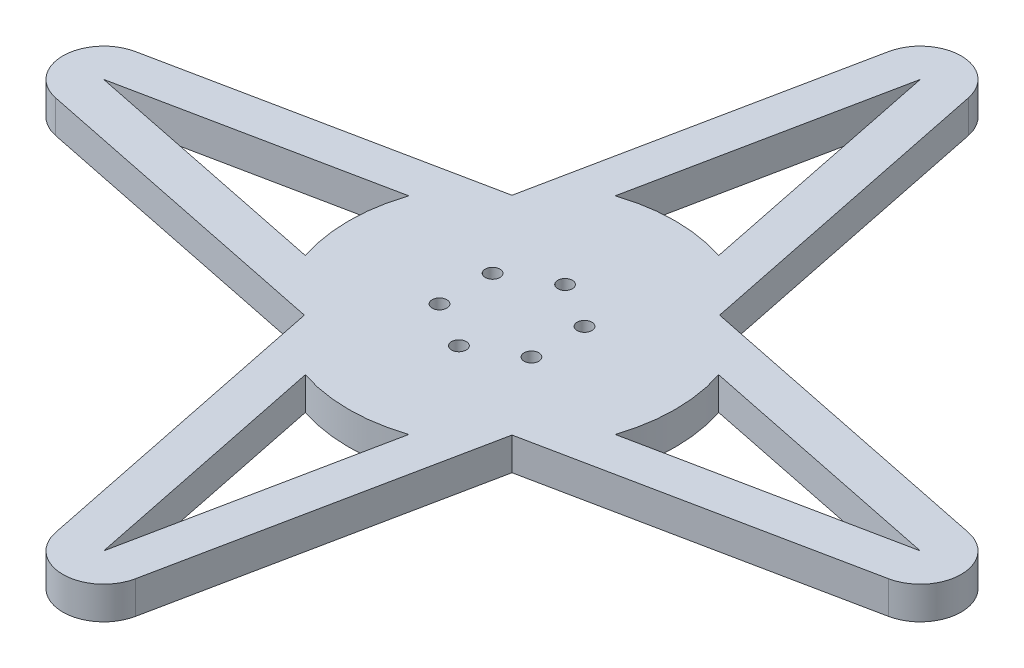
from build123d import *

# Parameters (mm, degrees)
BOSS_EXTRUDE1_DEPTH = 8
CIRPATTERN1_COUNT   = 4


# Read off the part's stored shape, not the designer's step: CSK for M3 Hex Socket Countersunk Cap Screw1
with BuildPart() as part:
    # Sketch2 → Boss-Extrude1 (new body)
    with BuildSketch(Plane(origin=(0, 0, 0), x_dir=(1, 0, 0), z_dir=(0, 1, 0))):
        with BuildLine():
            Line((6, -29.393876913), (102, -9.797958971))
            ThreePointArc((102, -9.797958971), (110, 0), (102, 9.797958971))
            Line((102, 9.797958971), (6, 29.393876913))
            ThreePointArc((6, 29.393876913), (-30, 0), (6, -29.393876913))
        make_face()
        with BuildLine():
            Line((37.941125497, -12.667714712), (100, 0))
            Line((100, 0), (37.941125497, 12.667714712))
            ThreePointArc((37.941125497, 12.667714712), (40, 0), (37.941125497, -12.667714712))
        make_face(mode=Mode.SUBTRACT)
    boss_extrude1 = extrude(amount=BOSS_EXTRUDE1_DEPTH)

    # CirPattern1: Boss-Extrude1 ×4 about axis
    cirpattern1_axis = Axis((0, 0, 0), (0, 1, 0))
    for i in range(1, CIRPATTERN1_COUNT):
        add(boss_extrude1.rotate(cirpattern1_axis, i * 360 / CIRPATTERN1_COUNT))

    # CSK for M3 Hex Socket Countersunk Ca 2 → CSK for M3 Hex Socket Countersunk Cap Screw1 (revolve, cut)
    with BuildSketch(Plane(origin=(-11.258330249, 0, -6.5), x_dir=(1, 0, 0), z_dir=(0, 0, 1))):
        Polygon((1.8, 1.56), (1.8, 8), (0, 8), (0, 0), (3.36, 0), align=None)
    revolve(axis=Axis((-11.258330249, 0, -6.5), (0, 1, 0)), mode=Mode.SUBTRACT)

    # CSK for M3 Hex Socket Countersunk Ca 3 o → CSK for M3 Hex Socket Countersunk Ca 3 (revolve, cut)
    with BuildSketch(Plane(origin=(-11.258330249, 0, 6.5), x_dir=(1, 0, 0), z_dir=(0, 0, 1))):
        Polygon((1.8, 1.56), (1.8, 8), (0, 8), (0, 0), (3.36, 0), align=None)
    revolve(axis=Axis((-11.258330249, 0, 6.5), (0, 1, 0)), mode=Mode.SUBTRACT)

    # CSK for M3 Hex Socket Countersunk Ca 4 o → CSK for M3 Hex Socket Countersunk Ca 4 (revolve, cut)
    with BuildSketch(Plane.XY.offset(13)):
        Polygon((1.8, 1.56), (1.8, 8), (0, 8), (0, 0), (3.36, 0), align=None)
    revolve(axis=Axis((0, 0, 13), (0, 1, 0)), mode=Mode.SUBTRACT)

    # CSK for M3 Hex Socket Countersunk Ca 5 o → CSK for M3 Hex Socket Countersunk Ca 5 (revolve, cut)
    with BuildSketch(Plane(origin=(11.258330249, 0, 6.5), x_dir=(1, 0, 0), z_dir=(0, 0, 1))):
        Polygon((1.8, 1.56), (1.8, 8), (0, 8), (0, 0), (3.36, 0), align=None)
    revolve(axis=Axis((11.258330249, 0, 6.5), (0, 1, 0)), mode=Mode.SUBTRACT)

    # CSK for M3 Hex Socket Countersunk Ca 6 o → CSK for M3 Hex Socket Countersunk Ca 6 (revolve, cut)
    with BuildSketch(Plane(origin=(11.258330249, 0, -6.5), x_dir=(1, 0, 0), z_dir=(0, 0, 1))):
        Polygon((1.8, 1.56), (1.8, 8), (0, 8), (0, 0), (3.36, 0), align=None)
    revolve(axis=Axis((11.258330249, 0, -6.5), (0, 1, 0)), mode=Mode.SUBTRACT)

    # CSK for M3 Hex Socket Countersunk Ca 7 o → CSK for M3 Hex Socket Countersunk Ca 7 (revolve, cut)
    with BuildSketch(Plane.XY.offset(-13)):
        Polygon((1.8, 1.56), (1.8, 8), (0, 8), (0, 0), (3.36, 0), align=None)
    revolve(axis=Axis((0, 0, -13), (0, 1, 0)), mode=Mode.SUBTRACT)


solid = part.part
